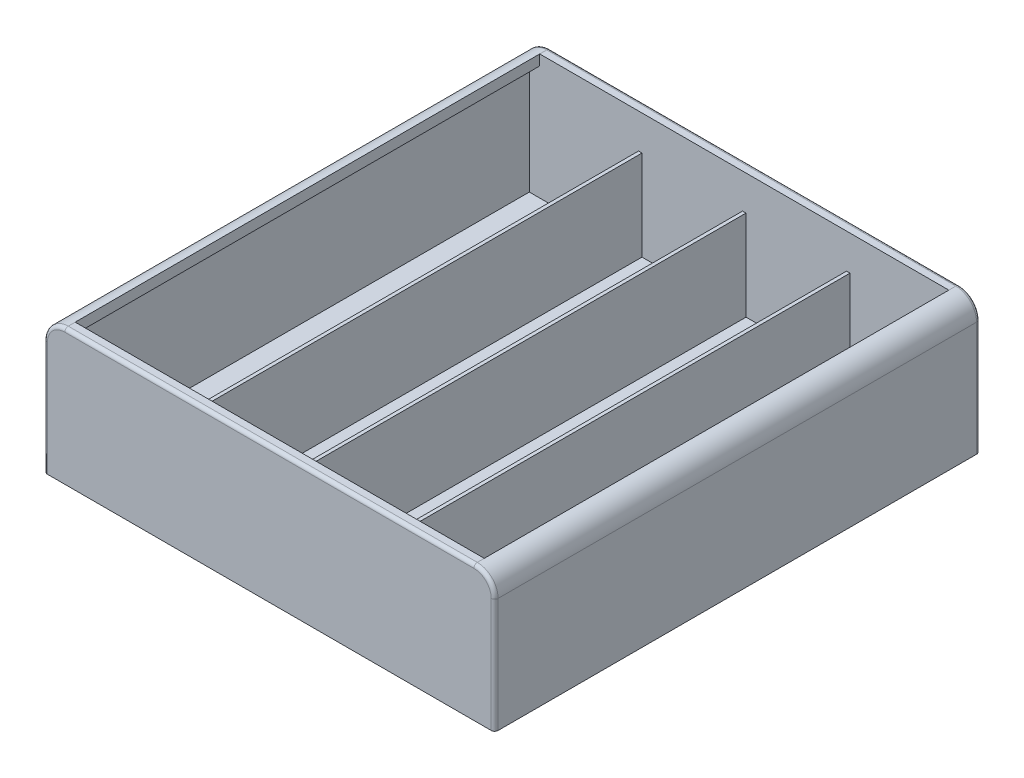
from build123d import *

# Parameters (mm, degrees)
SKETCH1_W           = 65
SKETCH1_H           = 70
BOSS_EXTRUDE1_DEPTH = 19.5
FILLET1_R           = 3
FILLET2_R           = 0.5
SHELL1_START        = -33.5
SHELL1_DEPTH        = 67
SKETCH2_W           = 0.5
SKETCH2_H           = 67
EXTRUDE_THIN1_DEPTH = 13
LPATTERN1_COUNT     = 2
LPATTERN1_PITCH     = 15
LPATTERN1_COL_COUNT = 2
LPATTERN1_COL_PITCH = 15


# Read off the part's stored shape, not the designer's step: Shell1
with BuildPart() as part:
    # Sketch1 → Boss-Extrude1 (new body)
    with BuildSketch(Plane(origin=(0, 0, 0), x_dir=(1, 0, 0), z_dir=(0, 1, 0))):
        Rectangle(SKETCH1_W, SKETCH1_H)
    extrude(amount=BOSS_EXTRUDE1_DEPTH)

    # Fillet1
    fillet1_edges = [part.edges().sort_by_distance(p)[0] for p in [
        (32.5, 19.5, 0),
        (-32.5, 19.5, 0),
    ]]
    fillet(fillet1_edges, radius=FILLET1_R)

    # Fillet2
    fillet2_edges = [part.edges().sort_by_distance(p)[0] for p in [
        (0, 19.5, 35),
        (0, 19.5, -35),
        (-32.5, 8.25, -35),
        (32.5, 8.25, -35),
        (-31.621320344, 18.621320344, -35),
        (31.621320344, 18.621320344, -35),
        (32.5, 8.25, 35),
        (-32.5, 8.25, 35),
        (-31.621320344, 18.621320344, 35),
        (31.621320344, 18.621320344, 35),
    ]]
    fillet(fillet2_edges, radius=FILLET2_R)

    # Shell1 outline → Shell1 (cut)
    with BuildSketch(Plane.XY.offset(SHELL1_START)):
        with BuildLine():
            Line((29.5, 18), (29.5, 19.5))
            Line((29.5, 19.5), (-29.5, 19.5))
            Line((-29.5, 19.5), (-29.5, 18))
            ThreePointArc((-29.5, 18), (-30.560660172, 17.560660172), (-31, 16.5))
            Line((-31, 16.5), (-31, 1.5))
            Line((-31, 1.5), (31, 1.5))
            Line((31, 1.5), (31, 16.5))
            ThreePointArc((31, 16.5), (30.560660172, 17.560660172), (29.5, 18))
        make_face()
    extrude(amount=SHELL1_DEPTH, mode=Mode.SUBTRACT)

    # Sketch2 → Extrude-Thin1 (add)
    with BuildSketch(Plane(origin=(0, 1.5, 0), x_dir=(1, 0, 0), z_dir=(0, 1, 0))):
        Rectangle(SKETCH2_W, SKETCH2_H)
    extrude_thin1 = extrude(amount=EXTRUDE_THIN1_DEPTH)

    # LPattern1: Extrude-Thin1 ×2
    with Locations(*[(-i * LPATTERN1_PITCH, 0, 0) for i in range(1, LPATTERN1_COUNT)]):
        add(extrude_thin1)

    # LPattern1 col: Extrude-Thin1 ×2
    with Locations(*[(i * LPATTERN1_COL_PITCH, 0, 0) for i in range(1, LPATTERN1_COL_COUNT)]):
        add(extrude_thin1)


solid = part.part
